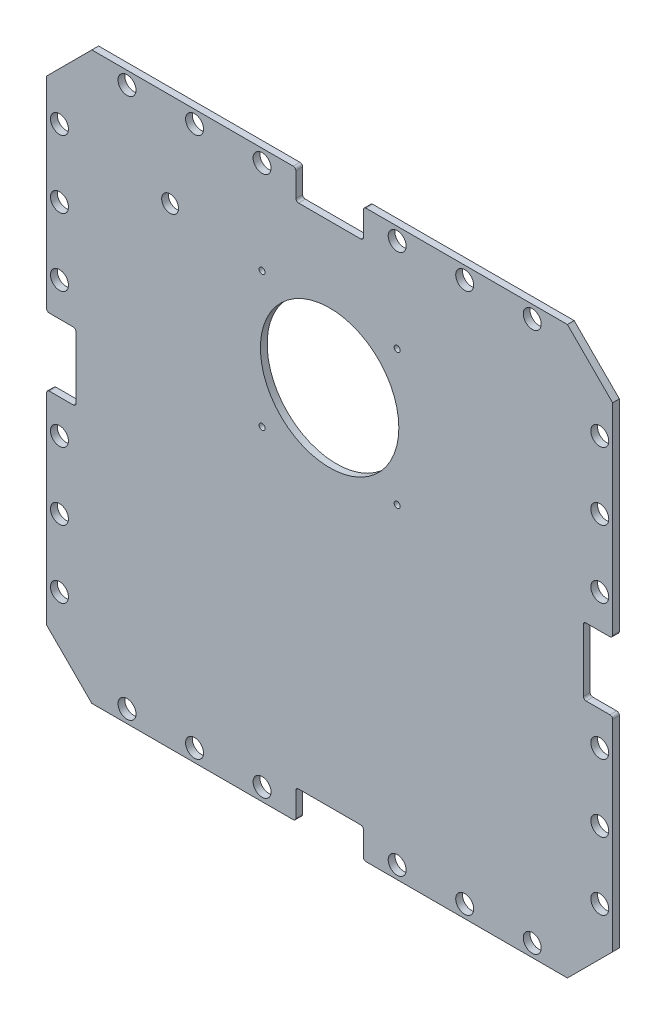
from build123d import *

# Parameters (mm, degrees)
SKETCH1_R             = 3.379999993
SKETCH1_R_2           = 3.379999996
SKETCH1_R_3           = 3.379999998
SKETCH1_R_4           = 1.13
SKETCH1_R_5           = 3.175
SKETCH1_R_6           = 3.38
SKETCH1_R_7           = 26.035
BOSS_EXTRUDE1_DEPTH   = 2.54
F_4_40_TAPPED_HOLE1_D = 2.2606
FILLET1_R             = 1


with BuildPart() as part:
    # Sketch1 → Boss-Extrude1 (new body)
    with BuildSketch(Plane.XY):
        Polygon((93.726, 0), (16.997849999, 0), (0, -16.997849999), (0, -93.726000007), (11, -93.726000007), (11, -119.126000007), (0, -119.126000007), (0, -195.854150007), (16.997849999, -212.852000007), (93.726000007, -212.852000007), (93.726000007, -201.852000007), (119.126000007, -201.852000007), (119.126000007, -212.852000007), (195.854150007, -212.852000007), (212.852000007, -195.854150007), (212.852000007, -119.126), (201.852000007, -119.126), (201.852000007, -93.726), (212.852000007, -93.726), (212.852000007, -16.997849999), (195.854150007, 0), (119.126, 0), (119.126, -11), (93.726, -11), align=None)
        with Locations((30.226, -208.026000005)):
            Circle(SKETCH1_R, mode=Mode.SUBTRACT)
        with Locations((4.825999998, -182.626000003)):
            Circle(SKETCH1_R_2, mode=Mode.SUBTRACT)
        with Locations((55.626, -208.026000005)):
            Circle(SKETCH1_R, mode=Mode.SUBTRACT)
        with Locations((81.026, -208.026000005)):
            Circle(SKETCH1_R, mode=Mode.SUBTRACT)
        with Locations((4.825999998, -157.226000003)):
            Circle(SKETCH1_R_2, mode=Mode.SUBTRACT)
        with Locations((4.825999998, -131.826000003)):
            Circle(SKETCH1_R_2, mode=Mode.SUBTRACT)
        with Locations((131.826, -208.026000005)):
            Circle(SKETCH1_R, mode=Mode.SUBTRACT)
        with Locations((157.226, -208.026000005)):
            Circle(SKETCH1_R, mode=Mode.SUBTRACT)
        with Locations((182.626, -208.026000005)):
            Circle(SKETCH1_R, mode=Mode.SUBTRACT)
        with Locations((208.026000002, -182.626000003)):
            Circle(SKETCH1_R_3, mode=Mode.SUBTRACT)
        with Locations((208.026000002, -157.226000003)):
            Circle(SKETCH1_R_3, mode=Mode.SUBTRACT)
        with Locations((208.026000002, -131.826000003)):
            Circle(SKETCH1_R_3, mode=Mode.SUBTRACT)
        with Locations((4.825999998, -81.026000003)):
            Circle(SKETCH1_R_2, mode=Mode.SUBTRACT)
        with Locations((4.825999998, -55.626000003)):
            Circle(SKETCH1_R_2, mode=Mode.SUBTRACT)
        with Locations((81.026000003, -90.74289)):
            Circle(SKETCH1_R_4, mode=Mode.SUBTRACT)
        with Locations((4.825999998, -30.226000003)):
            Circle(SKETCH1_R_2, mode=Mode.SUBTRACT)
        with Locations((46.426000003, -35.34289)):
            Circle(SKETCH1_R_5, mode=Mode.SUBTRACT)
        with Locations((30.226, -4.826000001)):
            Circle(SKETCH1_R_6, mode=Mode.SUBTRACT)
        with Locations((81.026000003, -39.94289)):
            Circle(SKETCH1_R_4, mode=Mode.SUBTRACT)
        with Locations((55.626, -4.826000001)):
            Circle(SKETCH1_R_6, mode=Mode.SUBTRACT)
        with Locations((81.026, -4.826000001)):
            Circle(SKETCH1_R_6, mode=Mode.SUBTRACT)
        with Locations((131.826000003, -90.74289)):
            Circle(SKETCH1_R_4, mode=Mode.SUBTRACT)
        with Locations((106.426000003, -65.34289)):
            Circle(SKETCH1_R_7, mode=Mode.SUBTRACT)
        with Locations((208.026000002, -81.026000003)):
            Circle(SKETCH1_R_3, mode=Mode.SUBTRACT)
        with Locations((208.026000002, -55.626000003)):
            Circle(SKETCH1_R_3, mode=Mode.SUBTRACT)
        with Locations((131.826000003, -39.94289)):
            Circle(SKETCH1_R_4, mode=Mode.SUBTRACT)
        with Locations((131.826, -4.826000001)):
            Circle(SKETCH1_R_6, mode=Mode.SUBTRACT)
        with Locations((157.226, -4.826000001)):
            Circle(SKETCH1_R_6, mode=Mode.SUBTRACT)
        with Locations((208.026000002, -30.226000003)):
            Circle(SKETCH1_R_3, mode=Mode.SUBTRACT)
        with Locations((182.626, -4.826000001)):
            Circle(SKETCH1_R_6, mode=Mode.SUBTRACT)
    extrude(amount=BOSS_EXTRUDE1_DEPTH)

    # #4-40 Tapped Hole1 (through all)
    with Locations(Plane(origin=(81.026000003, -39.94289, 2.54), x_dir=(1, 0, 0), z_dir=(0, 0, 1))):
        with Locations((0, 0), (50.8, 0), (50.8, -50.8), (0, -50.8)):
            Hole(F_4_40_TAPPED_HOLE1_D / 2)

    # Fillet1
    fillet1_edges = [part.edges().sort_by_distance(p)[0] for p in [
        (0, -93.726000007, 1.27),
        (11, -93.726000007, 1.27),
        (0, -119.126000007, 1.27),
        (11, -119.126000007, 1.27),
        (93.726000007, -212.852000007, 1.27),
        (93.726000007, -201.852000007, 1.27),
        (119.126000007, -212.852000007, 1.27),
        (119.126000007, -201.852000007, 1.27),
        (212.852000007, -119.126, 1.27),
        (201.852000007, -119.126, 1.27),
        (212.852000007, -93.726, 1.27),
        (201.852000007, -93.726, 1.27),
        (119.126, -11, 1.27),
        (119.126, 0, 1.27),
        (93.726, -11, 1.27),
        (93.726, 0, 1.27),
    ]]
    fillet(fillet1_edges, radius=FILLET1_R)


solid = part.part
